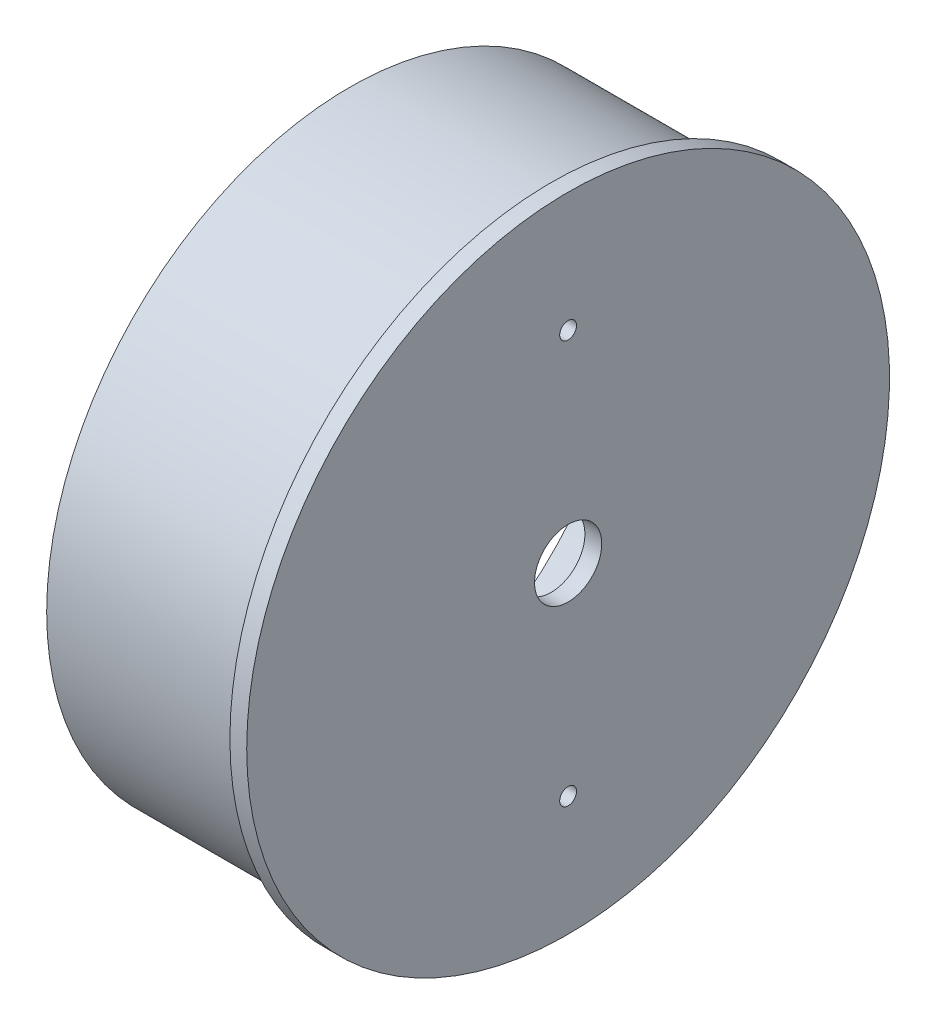
from build123d import *

# Parameters (mm, degrees)
SKETCH2_R          = 1.25
SKETCH2_R_2        = 5
CUT_EXTRUDE1_DEPTH = 10


with BuildPart() as part:
    # Sketch1 → Revolve1 (revolve)
    with BuildSketch(Plane.XY):
        Polygon((9.626364172, 21.551593752), (7.126364172, 21.551593752), (7.126364172, 18.801593752), (-22.873635828, 18.801593752), (-22.873635828, 16.301593752), (7.126364172, 16.301593752), (7.126364172, -26.248406248), (9.626364172, -26.248406248), align=None)
    revolve(axis=Axis((7.126364172, -26.248406248, 0), (1, 0, 0)))

    # Sketch2 → Cut-Extrude1 (cut)
    with BuildSketch(Plane(origin=(9.626364172, 0, 0), x_dir=(0, 0, -1), z_dir=(1, 0, 0))):
        with Locations((0, 3.751593752)):
            Circle(SKETCH2_R)
        with Locations((0, -56.248406248)):
            Circle(SKETCH2_R)
        with Locations((0, -26.248406248)):
            Circle(SKETCH2_R_2)
    extrude(amount=-CUT_EXTRUDE1_DEPTH, mode=Mode.SUBTRACT)


solid = part.part
